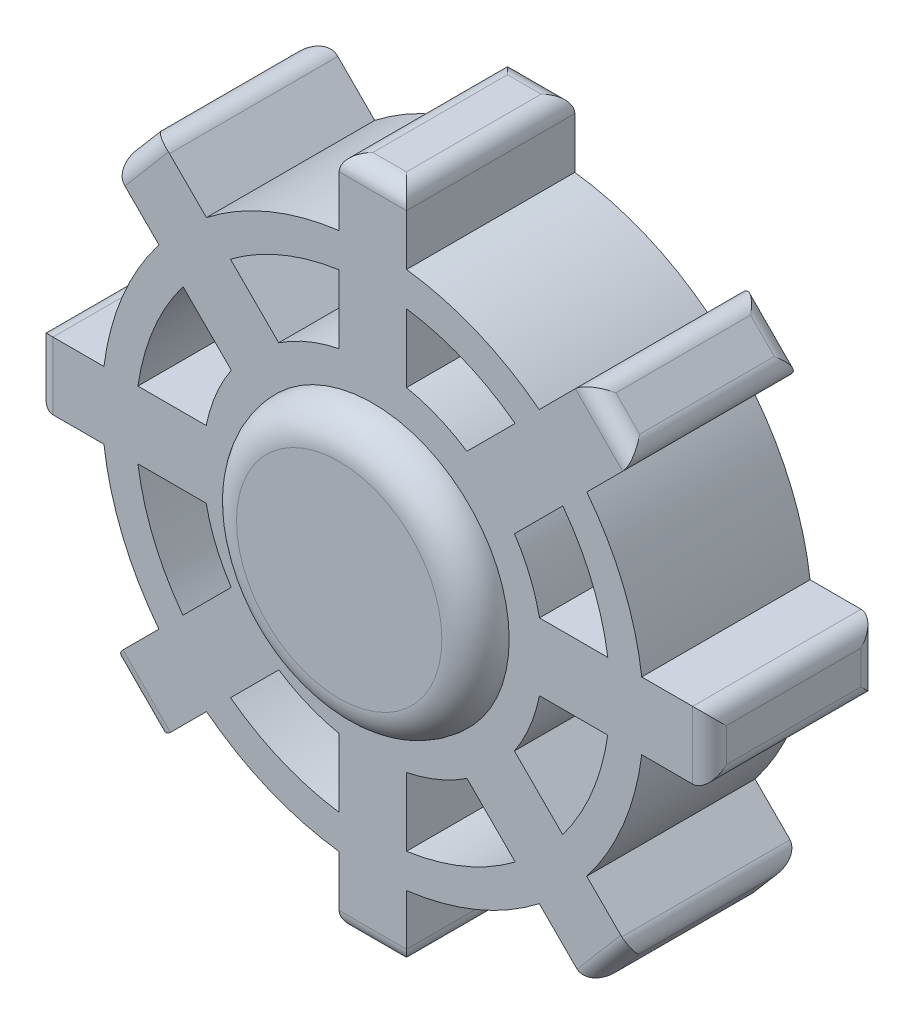
from build123d import *

# Parameters (mm, degrees)
BOSS_EXTRUDE1_DEPTH   = 5
BOSS_EXTRUDE1_2_DEPTH = 5
FILLET1_R             = 0.5
SKETCH2_R             = 8.05
SKETCH2_R_2           = 7.05
BOSS_EXTRUDE2_DEPTH   = 5
SKETCH6_R             = 4.05
BOSS_EXTRUDE8_DEPTH   = 1
FILLET2_R             = 1


with BuildPart() as part:
    # Sketch1 → Boss-Extrude1 (new body)
    with BuildSketch(Plane.XY):
        with BuildLine():
            Line((-1, -10), (1, -10))
            Line((1, -10), (1, -4.95))
            ThreePointArc((1, -4.95), (1.934056641, -4.664967836), (2.795786265, -4.205482037))
            Line((2.795786265, -4.205482037), (6.422695211, -7.832390982))
            Line((6.422695211, -7.832390982), (7.719440413, -6.309744641))
            Line((7.719440413, -6.309744641), (4.205482037, -2.795786265))
            ThreePointArc((4.205482037, -2.795786265), (4.664967836, -1.934056641), (4.95, -1))
            Line((4.95, -1), (10, -1))
            Line((10, -1), (10, 1))
            Line((10, 1), (4.95, 1))
            ThreePointArc((4.95, 1), (4.665589357, 1.932556844), (4.20727875, 2.793081724))
            Line((4.20727875, 2.793081724), (7.774746809, 6.360549784))
            Line((7.774746809, 6.360549784), (6.367388814, 7.78158584))
            Line((6.367388814, 7.78158584), (2.793081724, 4.20727875))
            ThreePointArc((2.793081724, 4.20727875), (1.932556844, 4.665589357), (1, 4.95))
            Line((1, 4.95), (1, 10))
            Line((1, 10), (-1, 10))
            Line((-1, 10), (-1, 4.95))
            ThreePointArc((-1, 4.95), (-1.934056641, 4.664967836), (-2.795786265, 4.205482037))
            Line((-2.795786265, 4.205482037), (-6.422695211, 7.832390982))
            Line((-6.422695211, 7.832390982), (-7.719440413, 6.309744641))
            Line((-7.719440413, 6.309744641), (-4.205482037, 2.795786265))
            ThreePointArc((-4.205482037, 2.795786265), (-4.664967836, 1.934056641), (-4.95, 1))
            Line((-4.95, 1), (-10, 1))
            Line((-10, 1), (-10, -1))
            Line((-10, -1), (-4.95, -1))
            ThreePointArc((-4.95, -1), (-4.665589357, -1.932556844), (-4.20727875, -2.793081724))
            Line((-4.20727875, -2.793081724), (-7.774746809, -6.360549784))
            Line((-7.774746809, -6.360549784), (-6.367388814, -7.78158584))
            Line((-6.367388814, -7.78158584), (-2.793081724, -4.20727875))
            ThreePointArc((-2.793081724, -4.20727875), (-1.932556844, -4.665589357), (-1, -4.95))
            Line((-1, -4.95), (-1, -10))
        make_face()
        with BuildLine():
            Line((0.35, -3.029851482), (0.35, -3.05))
            Line((0.35, -3.05), (0, -3.05))
            Line((0, -3.05), (-0.35, -3.05))
            Line((-0.35, -3.05), (-0.35, -3.029851482))
            ThreePointArc((-0.35, -3.029851482), (-3.05, 0), (-0.35, 3.029851482))
            Line((-0.35, 3.029851482), (-0.35, 3.05))
            Line((-0.35, 3.05), (0, 3.05))
            Line((0, 3.05), (0.35, 3.05))
            Line((0.35, 3.05), (0.35, 3.029851482))
            ThreePointArc((0.35, 3.029851482), (3.05, 0), (0.35, -3.029851482))
        make_face(mode=Mode.SUBTRACT)
    extrude(amount=BOSS_EXTRUDE1_DEPTH)

    # Fillet1
    fillet1_edges = [part.edges().sort_by_distance(p)[0] for p in [
        (-7.071067812, 7.071067812, 5),
        (-10, 0, 5),
        (-7.071067812, -7.071067812, 5),
        (0, -10, 5),
        (7.071067812, -7.071067812, 5),
        (10, 0, 5),
        (10, 0, 0),
        (7.071067812, -7.071067812, 0),
        (0, -10, 0),
        (-7.071067812, -7.071067812, 0),
        (-10, 0, 0),
        (-7.071067812, 7.071067812, 0),
        (0, 10, 0),
        (7.071067812, 7.071067812, 0),
        (7.071067812, 7.071067812, 5),
        (10, 1, 2.5),
        (10, -1, 2.5),
        (7.719440413, -6.309744641, 2.5),
        (6.422695211, -7.832390982, 2.5),
        (1, -10, 2.5),
        (-1, -10, 2.5),
        (-6.367388814, -7.78158584, 2.5),
        (-7.774746809, -6.360549784, 2.5),
        (-10, -1, 2.5),
        (-10, 1, 2.5),
        (-7.719440413, 6.309744641, 2.5),
        (-6.422695211, 7.832390982, 2.5),
        (-1, 10, 2.5),
        (1, 10, 2.5),
        (6.367388814, 7.78158584, 2.5),
        (7.774746809, 6.360549784, 2.5),
        (0, 10, 5),
    ]]
    fillet(fillet1_edges, radius=FILLET1_R)

    # Sketch2 → Boss-Extrude2 (add)
    with BuildSketch(Plane.XY.offset(5)):
        Circle(SKETCH2_R)
        Circle(SKETCH2_R_2, mode=Mode.SUBTRACT)
    extrude(amount=-BOSS_EXTRUDE2_DEPTH)


with BuildPart() as body_2:
    # Sketch1 → Boss-Extrude1 2 (new body)
    with BuildSketch(Plane.XY):
        with BuildLine():
            ThreePointArc((0, -3.05), (0.175289734, -3.044958704), (0.35, -3.029851482))
            Line((0.35, -3.029851482), (0.35, 3.029851482))
            ThreePointArc((0.35, 3.029851482), (0.175289734, 3.044958704), (0, 3.05))
            ThreePointArc((0, 3.05), (-0.175289734, 3.044958704), (-0.35, 3.029851482))
            Line((-0.35, 3.029851482), (-0.35, -3.029851482))
            ThreePointArc((-0.35, -3.029851482), (-0.175289734, -3.044958704), (0, -3.05))
        make_face()
    extrude(amount=BOSS_EXTRUDE1_2_DEPTH)

    # Sketch6 → Boss-Extrude8 (add)
    with BuildSketch(Plane.XY.offset(5)):
        Circle(SKETCH6_R)
    extrude(amount=BOSS_EXTRUDE8_DEPTH)

    # Fillet2
    fillet2_edges = [body_2.edges().sort_by_distance(p)[0] for p in [
        (-4.05, 0, 6),
    ]]
    fillet(fillet2_edges, radius=FILLET2_R - 0.0001)  # a hair under: the kernel refuses the full size


solid = Compound([part.part, body_2.part])
